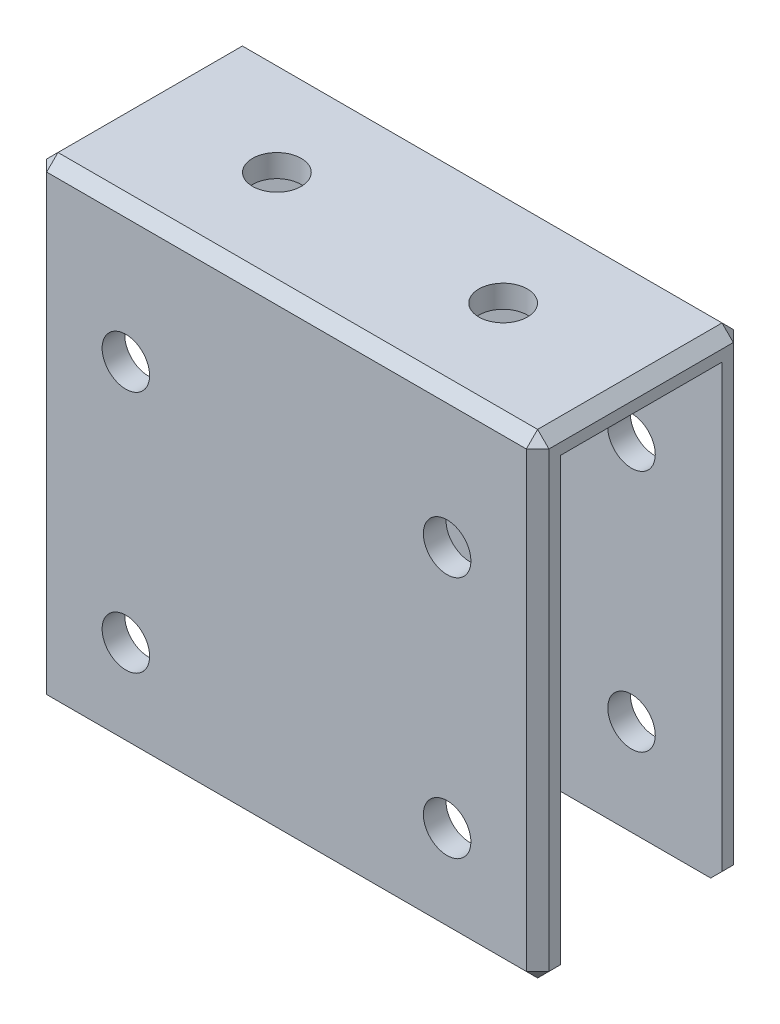
from build123d import *

# Parameters (mm, degrees)
SKETCH1_W           = 44.4
SKETCH1_H           = 40
SKETCH1_R           = 2.1
BOSS_EXTRUDE1_DEPTH = 2
SKETCH2_W           = 44.4
SKETCH2_H           = 18.3
BOSS_EXTRUDE2_DEPTH = 2
LPATTERN1_COUNT     = 2
LPATTERN1_PITCH     = 16.3
SKETCH3_R           = 2.15
CUT_EXTRUDE1_DEPTH  = 64.253853638
CHAMFER1_SIZE       = 1


with BuildPart() as part:
    # Sketch1 → Boss-Extrude1 (new body)
    with BuildSketch(Plane.XY):
        with Locations((22.2, 20)):
            Rectangle(SKETCH1_W, SKETCH1_H)
        with Locations((8, 8.476902454)):
            Circle(SKETCH1_R, mode=Mode.SUBTRACT)
        with Locations((8, 29.976902454)):
            Circle(SKETCH1_R, mode=Mode.SUBTRACT)
        with Locations((36.4, 29.976902454)):
            Circle(SKETCH1_R, mode=Mode.SUBTRACT)
        with Locations((36.4, 8.476902454)):
            Circle(SKETCH1_R, mode=Mode.SUBTRACT)
    boss_extrude1 = extrude(amount=BOSS_EXTRUDE1_DEPTH)

    # Sketch2 → Boss-Extrude2 (add)
    with BuildSketch(Plane(origin=(0, 40, 0), x_dir=(1, 0, 0), z_dir=(0, 1, 0))):
        with Locations((22.2, 7.15)):
            Rectangle(SKETCH2_W, SKETCH2_H)
    extrude(amount=BOSS_EXTRUDE2_DEPTH)

    # LPattern1: Boss-Extrude1 ×2
    with Locations(*[(0, 0, -i * LPATTERN1_PITCH) for i in range(1, LPATTERN1_COUNT)]):
        add(boss_extrude1)

    # Sketch3 → Cut-Extrude1 (cut, through all)
    with BuildSketch(Plane(origin=(0, 42, 0), x_dir=(1, 0, 0), z_dir=(0, 1, 0))):
        with Locations((12.2, 7.15)):
            Circle(SKETCH3_R)
        with Locations((32.2, 7.15)):
            Circle(SKETCH3_R)
    extrude(amount=-CUT_EXTRUDE1_DEPTH, mode=Mode.SUBTRACT)

    # Chamfer1
    chamfer1_edges = [part.edges().sort_by_distance(p)[0] for p in [
        (22.2, 42, -16.3),
        (0, 42, -7.15),
        (0, 21, -16.3),
        (22.2, 42, 2),
        (0, 21, 2),
        (0, 0, -15.3),
        (0, 0, 1),
        (22.2, 0, 2),
        (44.4, 0, 1),
        (44.4, 21, 2),
        (44.4, 42, -7.15),
        (44.4, 21, -16.3),
        (44.4, 0, -15.3),
        (22.2, 0, -16.3),
    ]]
    chamfer(chamfer1_edges, length=CHAMFER1_SIZE)


solid = part.part
